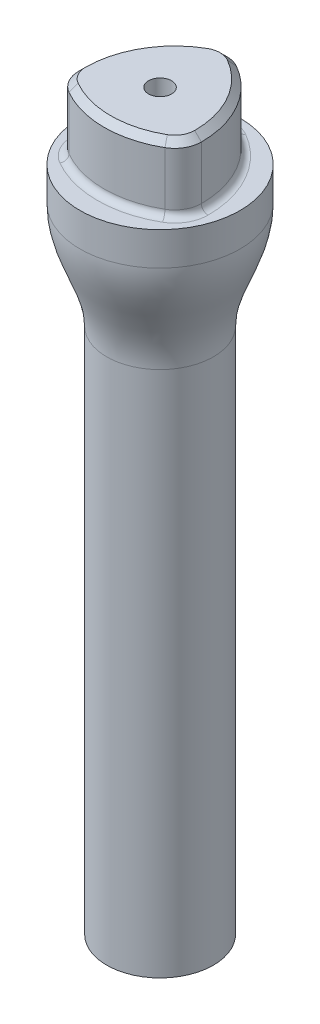
from build123d import *

# Parameters (mm, degrees)
BOSS_EXTRUDE2_DEPTH       = 10
F_8_32_TAPPED_HOLE2_D     = 3.4544
F_8_32_TAPPED_HOLE2_DEPTH = 12
F_8_32_TAPPED_HOLE2_TIP   = 1.037806461
FILLET1_R                 = 1
CHAMFER1_SIZE             = 1


with BuildPart() as part:
    # Sketch6 → Revolve1 (revolve)
    with BuildSketch(Plane.XY):
        with BuildLine():
            Line((0, 0), (-8, 0))
            Line((-8, 0), (-8, 79))
            add(Edge.make_bspline(
                [(-12, 95), (-12, 89), (-8, 85), (-8, 79)],
                knots=[0, 0, 0, 0, 1, 1, 1, 1], degree=3))
            Line((-12, 95), (-12, 100))
            Line((-12, 100), (0, 100))
            Line((0, 100), (0, 0))
        make_face()
    revolve(axis=Axis((0, 0, 0), (0, 1, 0)))

    # Sketch7 → Boss-Extrude2 (add)
    with BuildSketch(Plane(origin=(0, 100, 0), x_dir=(1, 0, 0), z_dir=(0, 1, 0))):
        with BuildLine():
            ThreePointArc((-2, 9.464101615), (0, 10), (2, 9.464101615))
            ThreePointArc((2, 9.464101615), (7.267949192, 4.196152423), (9.196152423, -3))
            ThreePointArc((9.196152423, -3), (8.660254038, -5), (7.196152423, -6.464101615))
            ThreePointArc((7.196152423, -6.464101615), (0, -8.392304845), (-7.196152423, -6.464101615))
            ThreePointArc((-7.196152423, -6.464101615), (-8.660254038, -5), (-9.196152423, -3))
            ThreePointArc((-9.196152423, -3), (-7.267949192, 4.196152423), (-2, 9.464101615))
        make_face()
    extrude(amount=BOSS_EXTRUDE2_DEPTH)

    # #8-32 Tapped Hole2
    with Locations(Plane(origin=(0, 110, 0), x_dir=(1, 0, 0), z_dir=(0, 1, 0))):
        with Locations((0, 0)):
            Hole(F_8_32_TAPPED_HOLE2_D / 2, depth=F_8_32_TAPPED_HOLE2_DEPTH)
            with Locations((0, 0, -(F_8_32_TAPPED_HOLE2_DEPTH + F_8_32_TAPPED_HOLE2_TIP / 2))):  # 118° drill point
                Cone(0, F_8_32_TAPPED_HOLE2_D / 2, F_8_32_TAPPED_HOLE2_TIP, mode=Mode.SUBTRACT)

    # Fillet1
    fillet1_edges = [part.edges().sort_by_distance(p)[0] for p in [
        (0, 100, -10),
        (7.267949192, 100, -4.196152423),
        (8.660254038, 100, 5),
        (0, 100, 8.392304845),
        (-8.660254038, 100, 5),
        (-7.267949192, 100, -4.196152423),
    ]]
    fillet(fillet1_edges, radius=FILLET1_R)

    # Chamfer1
    chamfer1_edges = [part.edges().sort_by_distance(p)[0] for p in [
        (8.660254038, 110, 5),
        (7.267949192, 110, -4.196152423),
        (0, 110, 8.392304845),
        (0, 110, -10),
        (-8.660254038, 110, 5),
        (-7.267949192, 110, -4.196152423),
    ]]
    chamfer(chamfer1_edges, length=CHAMFER1_SIZE)


solid = part.part
